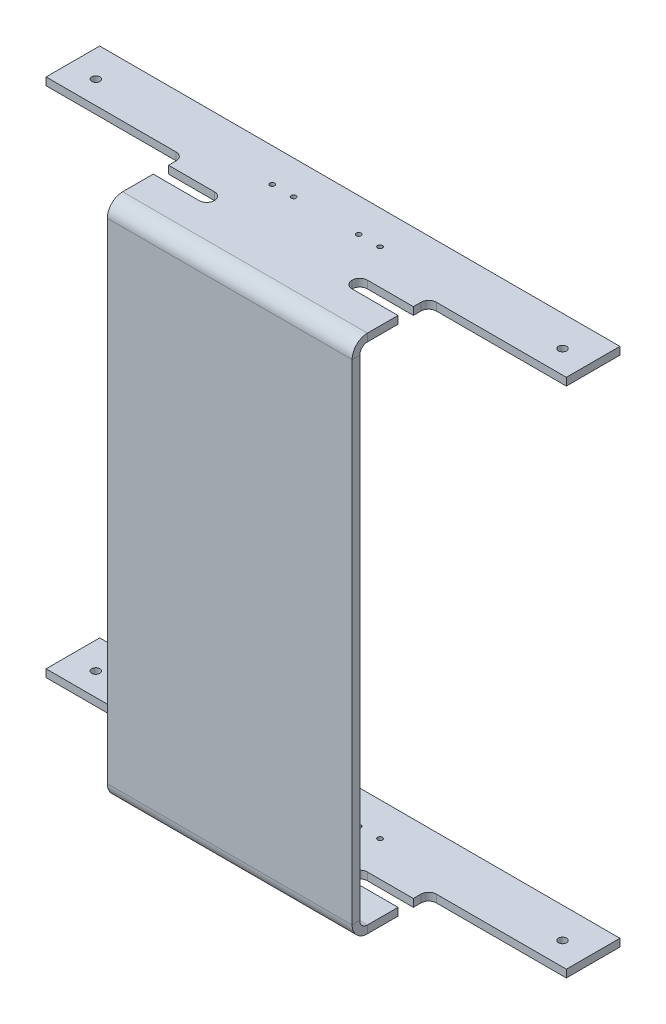
from build123d import *

# Parameters (mm, degrees)
BOSS_EXTRUDE1_DEPTH              = 6.35
SKETCH2_W                        = 203.2
SKETCH2_H                        = 6.35
BOSS_EXTRUDE2_DEPTH              = 419.1
BOSS_EXTRUDE3_DEPTH              = 6.35
F_17_64_0_26563_DIAMETER_HOLE1_D = 6.747002
F_5_32_0_15625_DIAMETER_HOLE1_D  = 3.96875
FILLET1_R                        = 6.35
CONVERT_SOLID1_START             = -101.6
CONVERT_SOLID1_DEPTH             = 203.2
CONVERT_SOLID1_2_DEPTH           = 203.2
FILLET2_R                        = 6.35


# Read off the part's stored shape, not the designer's step: Convert-Solid1
with BuildPart() as part:
    # Sketch1 → Boss-Extrude1 (new body)
    with BuildSketch(Plane(origin=(0, 0, 0), x_dir=(1, 0, 0), z_dir=(0, 1, 0))):
        Polygon((-215.9, 107.95), (-215.9, 63.5), (-101.6, 63.5), (-101.6, 50.8), (-57.15, 50.8), (-57.15, 38.1), (-101.6, 38.1), (-101.6, 0), (101.6, 0), (101.6, 38.1), (57.15, 38.1), (57.15, 50.8), (101.6, 50.8), (101.6, 63.5), (215.9, 63.5), (215.9, 107.95), align=None)
    extrude(amount=BOSS_EXTRUDE1_DEPTH)

    # Sketch2 → Boss-Extrude2 (add)
    with BuildSketch(Plane.XZ):
        with Locations((0, -3.175)):
            Rectangle(SKETCH2_W, SKETCH2_H)
    extrude(amount=BOSS_EXTRUDE2_DEPTH)

    # Sketch3 → Boss-Extrude3 (add)
    with BuildSketch(Plane.XZ.offset(419.1)):
        Polygon((-101.6, -50.8), (-101.6, -63.5), (-215.9, -63.5), (-215.9, -107.95), (215.9, -107.95), (215.9, -63.5), (101.6, -63.5), (101.6, -50.8), (57.15, -50.8), (57.15, -38.1), (101.6, -38.1), (101.6, 0), (-101.6, 0), (-101.6, -38.1), (-57.15, -38.1), (-57.15, -50.8), align=None)
    extrude(amount=BOSS_EXTRUDE3_DEPTH)

    # 17/64 (0.26563) Diameter Hole1 (through all)
    with Locations(Plane(origin=(0, 6.35, 0), x_dir=(1, 0, 0), z_dir=(0, 1, 0))):
        with Locations((-193.675, 82.55), (193.675, 82.55)):
            Hole(F_17_64_0_26563_DIAMETER_HOLE1_D / 2)

    # 5/32 (0.15625) Diameter Hole1 (through all)
    with Locations(Plane(origin=(0, 6.35, 0), x_dir=(1, 0, 0), z_dir=(0, 1, 0))):
        with Locations((-44.7675, 80.01), (-26.9875, 80.01), (26.9875, 80.01), (44.7675, 80.01)):
            Hole(F_5_32_0_15625_DIAMETER_HOLE1_D / 2)

    # Fillet1
    fillet1_edges = [part.edges().sort_by_distance(p)[0] for p in [
        (57.15, -422.275, -38.1),
        (57.15, -422.275, -50.8),
        (-57.15, -422.275, -38.1),
        (-57.15, -422.275, -50.8),
        (57.15, 3.175, -38.1),
        (57.15, 3.175, -50.8),
        (-57.15, 3.175, -38.1),
        (-57.15, 3.175, -50.8),
    ]]
    fillet(fillet1_edges, radius=FILLET1_R - 0.0001)  # a hair under: the kernel refuses the full size

    # Convert-Solid1 outline → Convert-Solid1 (cut)
    with BuildSketch(Plane.YZ.offset(CONVERT_SOLID1_START)):
        with BuildLine():
            Line((6.35, 0), (-6.35, 0))
            ThreePointArc((-6.35, 0), (2.630256121, -3.719743879), (6.35, -12.7))
            Line((6.35, -12.7), (6.35, 0))
        make_face()
        with BuildLine():
            ThreePointArc((-425.45, -12.7), (-421.730256121, -3.719743879), (-412.75, 0))
            Line((-412.75, 0), (-425.45, 0))
            Line((-425.45, 0), (-425.45, -12.7))
        make_face()
    extrude(amount=CONVERT_SOLID1_DEPTH, mode=Mode.SUBTRACT)

    # Convert-Solid1 2 outline → Convert-Solid1 2 (add)
    with BuildSketch(Plane.YZ.offset(CONVERT_SOLID1_START)):
        with BuildLine():
            Line((0, -6.35), (-6.35, -6.35))
            ThreePointArc((-6.35, -6.35), (-1.859871939, -8.209871939), (0, -12.7))
            Line((0, -12.7), (0, -6.35))
        make_face()
        with BuildLine():
            ThreePointArc((-419.1, -12.7), (-417.240128061, -8.209871939), (-412.75, -6.35))
            Line((-412.75, -6.35), (-419.1, -6.35))
            Line((-419.1, -6.35), (-419.1, -12.7))
        make_face()
    extrude(amount=CONVERT_SOLID1_2_DEPTH)

    # Fillet2
    fillet2_edges = [part.edges().sort_by_distance(p)[0] for p in [
        (101.6, 3.175, -63.5),
        (-101.6, 3.175, -63.5),
        (-101.6, -422.275, -63.5),
        (101.6, -422.275, -63.5),
    ]]
    fillet(fillet2_edges, radius=FILLET2_R)


solid = part.part
